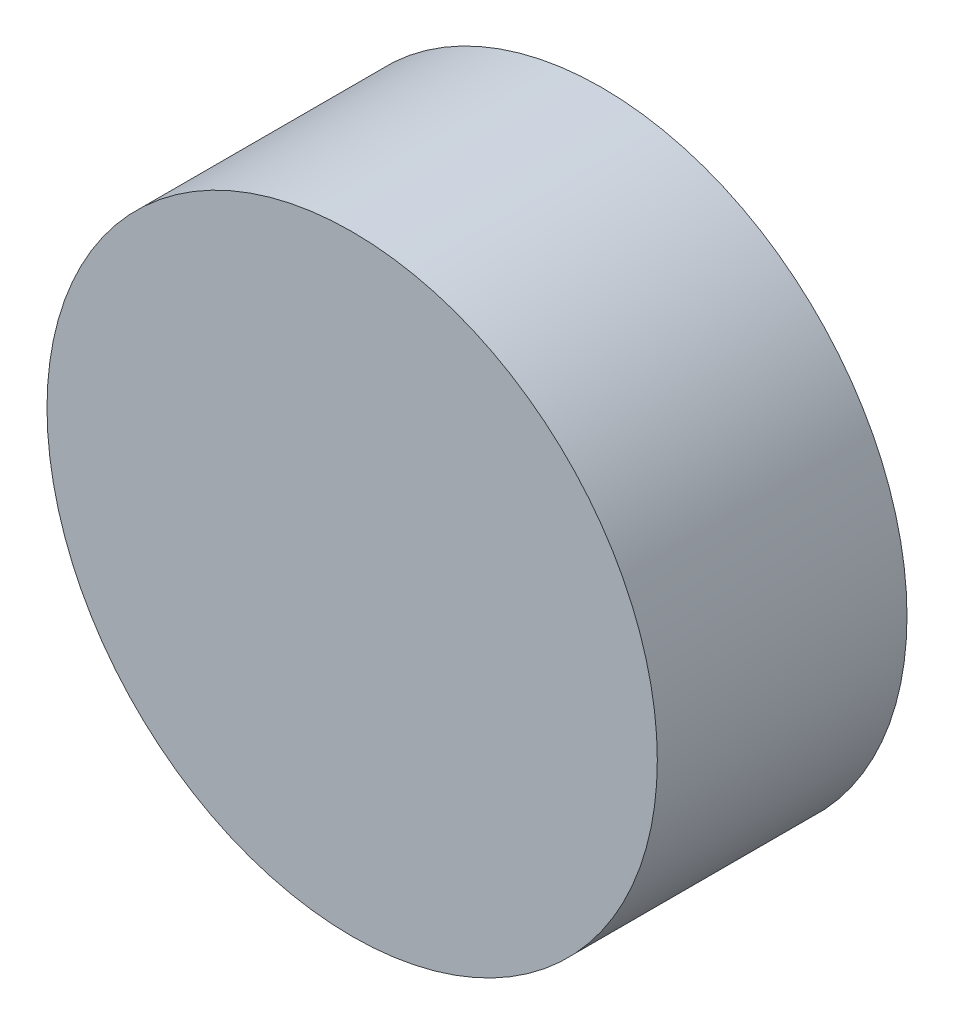
from build123d import *


with BuildPart() as part:
    # Sketch3 → Revolve1 (revolve)
    with BuildSketch(Plane(origin=(0, 0, 0), x_dir=(-1, 0, 0), z_dir=(0, -1, 0))):
        Polygon((31.75, -25.4), (31.75, 0), (34.925, 0), (34.925, -25.4), (34.925, -28.575), (0, -28.575), (0, -25.4), align=None)
    revolve(axis=Axis((0, 0, 0), (0, 0, 1)))


solid = part.part
